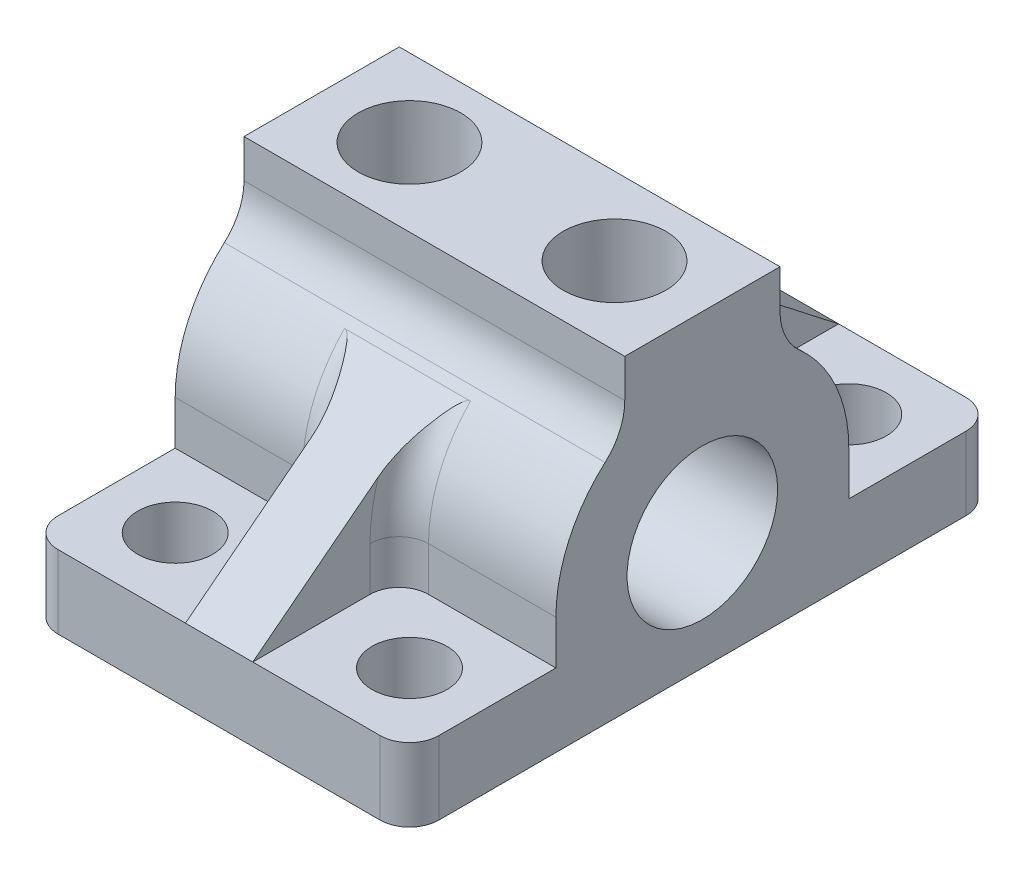
from build123d import *

# Parameters (mm, degrees)
SKETCH1_R           = 3.2639
BOSS_EXTRUDE1_DEPTH = 8.255
BOSS_EXTRUDE2_DEPTH = 1.4605
SKETCH3_R           = 1.6256
CUT_EXTRUDE1_DEPTH  = 18.250508688
CUT_EXTRUDE2_DEPTH  = 42.211451079
SKETCH6_W           = 16.51
SKETCH6_H           = 6.731
BOSS_EXTRUDE3_DEPTH = 2.921
SKETCH5_R           = 2.2225
CUT_EXTRUDE3_DEPTH  = 6.35
FILLET1_R           = 1.27
FILLET2_R           = 2.54


with BuildPart() as part:
    # Sketch1 → Boss-Extrude1 (new, symmetric)
    with BuildSketch(Plane(origin=(0, 0, 0), x_dir=(0, 0, -1), z_dir=(1, 0, 0))):
        with BuildLine():
            Line((12.7, 24.13), (-12.7, 24.13))
            Line((-12.7, 24.13), (-12.7, 27.305))
            Line((-12.7, 27.305), (-6.35, 27.305))
            Line((-6.35, 27.305), (-6.35, 29.21))
            ThreePointArc((-6.35, 29.21), (0, 35.56), (6.35, 29.21))
            Line((6.35, 29.21), (6.35, 27.305))
            Line((6.35, 27.305), (12.7, 27.305))
            Line((12.7, 27.305), (12.7, 24.13))
        make_face()
        with Locations((0, 29.21)):
            Circle(SKETCH1_R, mode=Mode.SUBTRACT)
    extrude(amount=BOSS_EXTRUDE1_DEPTH, both=True)

    # Sketch2 → Boss-Extrude2 (add, symmetric)
    with BuildSketch(Plane(origin=(0, 0, 0), x_dir=(0, 0, -1), z_dir=(1, 0, 0))):
        Polygon((-4.534807052, 33.655), (-12.7, 27.305), (-4.534807052, 27.305), align=None)
        Polygon((4.534807052, 27.305), (4.534807052, 33.655), (12.7, 27.305), align=None)
    extrude(amount=BOSS_EXTRUDE2_DEPTH, both=True)

    # Sketch3 → Cut-Extrude1 (cut, through all)
    with BuildSketch(Plane(origin=(0, 27.305, 0), x_dir=(1, 0, 0), z_dir=(0, 1, 0))):
        with Locations((-5.08, 9.525)):
            Circle(SKETCH3_R)
        with Locations((5.08, 9.525)):
            Circle(SKETCH3_R)
        with Locations((5.08, -9.525)):
            Circle(SKETCH3_R)
        with Locations((-5.08, -9.525)):
            Circle(SKETCH3_R)
    extrude(amount=-CUT_EXTRUDE1_DEPTH, mode=Mode.SUBTRACT)

    # Sketch4 → Cut-Extrude2 (cut, through all)
    with BuildSketch(Plane(origin=(8.255, 0, 0), x_dir=(0, 0, -1), z_dir=(1, 0, 0))):
        with BuildLine():
            Line((3.3655, 34.594785024), (-3.3655, 34.594785024))
            ThreePointArc((-3.3655, 34.594785024), (0, 35.56), (3.3655, 34.594785024))
        make_face()
    extrude(amount=-CUT_EXTRUDE2_DEPTH, mode=Mode.SUBTRACT)

    # Sketch6 → Boss-Extrude3 (add)
    with BuildSketch(Plane(origin=(0, 34.594785024, 0), x_dir=(1, 0, 0), z_dir=(0, 1, 0))):
        Rectangle(SKETCH6_W, SKETCH6_H)
    extrude(amount=BOSS_EXTRUDE3_DEPTH)

    # Sketch5 → Cut-Extrude3 (cut)
    with BuildSketch(Plane(origin=(0, 37.515785024, 0), x_dir=(1, 0, 0), z_dir=(0, 1, 0))):
        with Locations((-4.445, 0)):
            Circle(SKETCH5_R)
        with Locations((4.445, 0)):
            Circle(SKETCH5_R)
    extrude(amount=-CUT_EXTRUDE3_DEPTH, mode=Mode.SUBTRACT)

    # Fillet1
    fillet1_edges = [part.edges().sort_by_distance(p)[0] for p in [
        (-1.4605, 31.610674407, 5.878712647),
        (1.4605, 31.610674407, 5.878712647),
        (-1.4605, 31.610674407, -5.878712647),
        (1.4605, 31.610674407, -5.878712647),
        (-1.4605, 28.2575, 6.35),
        (1.4605, 28.2575, 6.35),
        (-1.4605, 28.2575, -6.35),
        (1.4605, 28.2575, -6.35),
        (-8.255, 25.7175, -12.7),
        (8.255, 25.7175, -12.7),
        (-8.255, 25.7175, 12.7),
        (8.255, 25.7175, 12.7),
    ]]
    fillet(fillet1_edges, radius=FILLET1_R)

    # Fillet2
    fillet2_edges = [part.edges().sort_by_distance(p)[0] for p in [
        (0, 34.594785024, -3.3655),
        (0, 34.594785024, 3.3655),
    ]]
    fillet(fillet2_edges, radius=FILLET2_R)


solid = part.part
